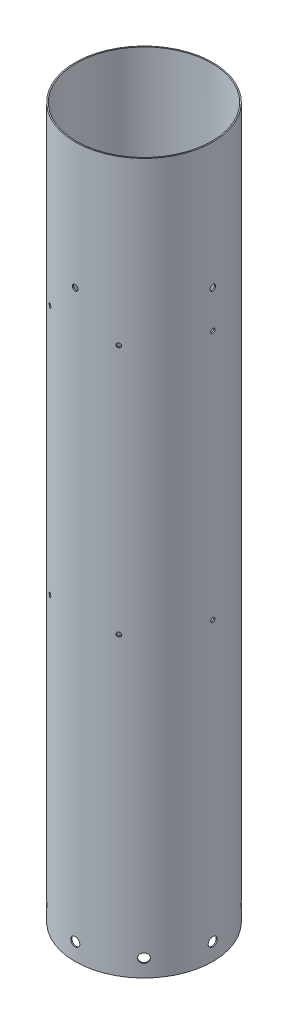
from build123d import *

# Parameters (mm, degrees)
SKETCH2_R                           = 76.2
SKETCH2_R_2                         = 74.93
BOSS_EXTRUDE1_DEPTH                 = 785.495
N2_TO_LOX_LOX_SIDE_HOLES_REACH      = 820.024
N2_TO_LOX_LOX_SIDE_HOLES_END_RADIUS = 76.2
SKETCH5_R                           = 5.0165
CIRPATTERN3_COUNT                   = 8
SKETCH7_R                           = 2.381249991
SKETCH7_R_2                         = 2.378452309
CUT_EXTRUDE2_DEPTH                  = 793.852618847
CIRPATTERN4_COUNT                   = 4
CIRPATTERN4_ANGLE                   = 180
SKETCH9_R                           = 3.175
CUT_EXTRUDE3_DEPTH                  = 793.852618848
CIRPATTERN5_COUNT                   = 3
CIRPATTERN5_ANGLE                   = 180


with BuildPart() as part:
    # Sketch2 → Boss-Extrude1 (new body)
    with BuildSketch(Plane(origin=(0, 0, 0), x_dir=(1, 0, 0), z_dir=(0, 1, 0))):
        Circle(SKETCH2_R)
        Circle(SKETCH2_R_2, mode=Mode.SUBTRACT)
    extrude(amount=BOSS_EXTRUDE1_DEPTH)

    # N2 to LOX, LOX Side Holes: up to this cylinder (the profile starts inside it)
    n2_to_lox_lox_side_holes_end = Plane(origin=(0, 19.05, 0), z_dir=(0, -1, 0)) * Cylinder(N2_TO_LOX_LOX_SIDE_HOLES_END_RADIUS, 1793.448, mode=Mode.PRIVATE)
    # Sketch5 → N2 to LOX, LOX Side Holes (cut, up to the surface)
    with BuildSketch(Plane(origin=(0, -25.4, 0), x_dir=(0, 0, 1), z_dir=(1, 0, 0)), mode=Mode.PRIVATE) as n2_to_lox_lox_side_holes_sk1:
        with Locations((0, -44.45)):
            Circle(SKETCH5_R)
    n2_to_lox_lox_side_holes_tool1 = extrude(n2_to_lox_lox_side_holes_sk1.sketch, amount=N2_TO_LOX_LOX_SIDE_HOLES_REACH, mode=Mode.PRIVATE) & n2_to_lox_lox_side_holes_end
    n2_to_lox_lox_side_holes = n2_to_lox_lox_side_holes_tool1.solids().sort_by_distance((0, 19.05, 0))[0]
    add(n2_to_lox_lox_side_holes, mode=Mode.SUBTRACT)

    # CirPattern3: N2 to LOX, LOX Side Holes ×8 about axis
    cirpattern3_axis = Axis((0, 0, 0), (0, 1, 0))
    for i in range(1, CIRPATTERN3_COUNT):
        add(n2_to_lox_lox_side_holes.rotate(cirpattern3_axis, i * 360 / CIRPATTERN3_COUNT), mode=Mode.SUBTRACT)

    # Sketch7 → Cut-Extrude2 (cut, symmetric)
    with BuildSketch(Plane(origin=(0, 0, 0), x_dir=(0, 0, -1), z_dir=(1, 0, 0))):
        with Locations((-4e-09, 604.519999983)):
            Circle(SKETCH7_R)
        with Locations((-4e-09, 327.33028923)):
            Circle(SKETCH7_R_2)
    cut_extrude2 = extrude(amount=CUT_EXTRUDE2_DEPTH, both=True, mode=Mode.SUBTRACT)

    # CirPattern4: Cut-Extrude2 ×4 about axis
    cirpattern4_axis = Axis((0, 785.495, 0), (0, -1, 0))
    for i in range(1, CIRPATTERN4_COUNT):
        add(cut_extrude2.rotate(cirpattern4_axis, i * CIRPATTERN4_ANGLE / (CIRPATTERN4_COUNT - 1)), mode=Mode.SUBTRACT)

    # Sketch9 → Cut-Extrude3 (cut, symmetric)
    with BuildSketch(Plane(origin=(0, 0, 0), x_dir=(0, 0, -1), z_dir=(1, 0, 0))):
        with Locations((0, 645.795)):
            Circle(SKETCH9_R)
    cut_extrude3 = extrude(amount=CUT_EXTRUDE3_DEPTH, both=True, mode=Mode.SUBTRACT)

    # CirPattern5: Cut-Extrude3 ×3 about axis
    cirpattern5_axis = Axis((0, 785.495, 0), (0, -1, 0))
    for i in range(1, CIRPATTERN5_COUNT):
        add(cut_extrude3.rotate(cirpattern5_axis, i * CIRPATTERN5_ANGLE / (CIRPATTERN5_COUNT - 1)), mode=Mode.SUBTRACT)


solid = part.part
